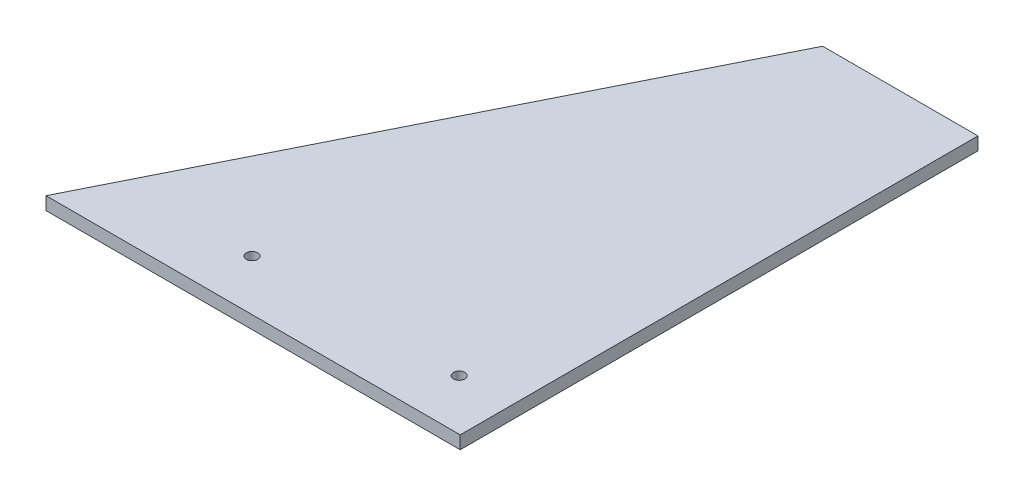
from build123d import *

# Parameters (mm, degrees)
BOSS_EXTRUDE1_DEPTH = 3.175
SKETCH2_R           = 1.397
CUT_EXTRUDE1_DEPTH  = 12.7


with BuildPart() as part:
    # Sketch1 → Boss-Extrude1 (new body)
    with BuildSketch(Plane(origin=(0, 0, 0), x_dir=(1, 0, 0), z_dir=(0, 1, 0))):
        Polygon((0, 0), (0, 127), (-38.1, 127), (-101.6, 0), align=None)
    extrude(amount=BOSS_EXTRUDE1_DEPTH)

    # Sketch2 → Cut-Extrude1 (cut)
    with BuildSketch(Plane(origin=(0, 0, 0), x_dir=(-1, 0, 0), z_dir=(0, -1, 0))):
        with Locations((63.5, 12.446)):
            Circle(SKETCH2_R)
        with Locations((12.7, 12.446)):
            Circle(SKETCH2_R)
    extrude(amount=-CUT_EXTRUDE1_DEPTH, mode=Mode.SUBTRACT)


solid = part.part
